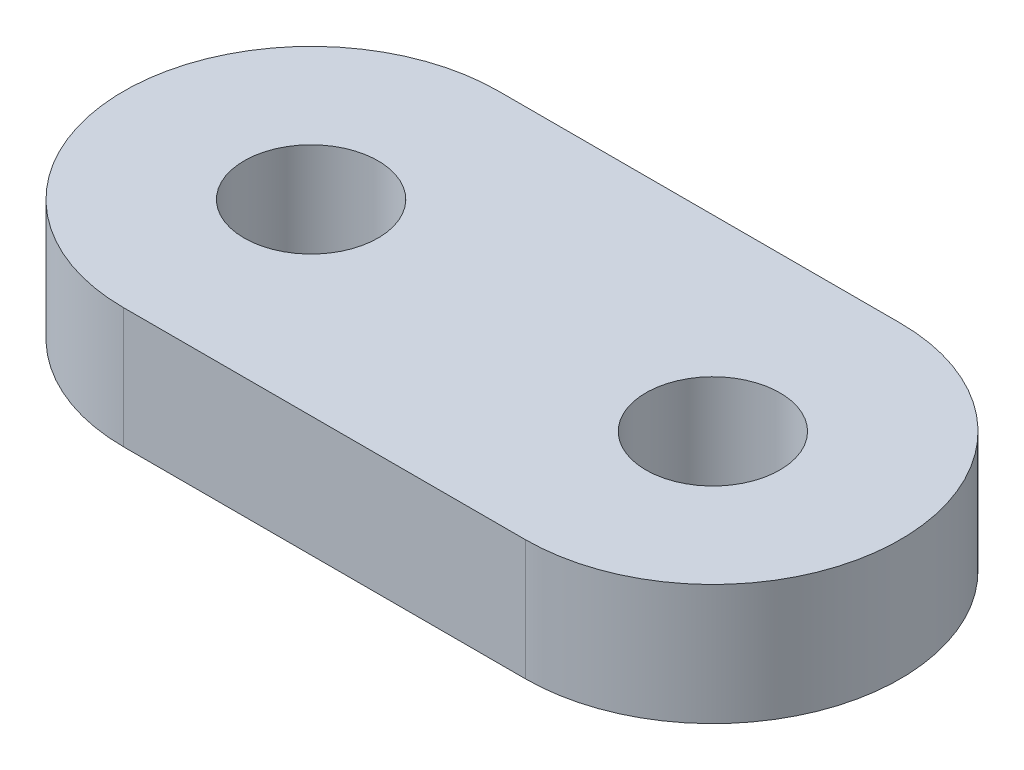
from build123d import *

# Parameters (mm, degrees)
SKETCH_1_R      = 2.5
EXTRUDE_1_DEPTH = 4.5


with BuildPart() as part:
    # Эскиз1 → Вытянуть1 (new body)
    with BuildSketch(Plane(origin=(0, 0, 0), x_dir=(1, 0, 0), z_dir=(0, 1, 0))):
        with BuildLine():
            Line((15, 7), (30, 7))
            ThreePointArc((30, 7), (37, 0), (30, -7))
            Line((30, -7), (15, -7))
            ThreePointArc((15, -7), (8, 0), (15, 7))
        make_face()
        with Locations((15, 0)):
            Circle(SKETCH_1_R, mode=Mode.SUBTRACT)
        with Locations((30, 0)):
            Circle(SKETCH_1_R, mode=Mode.SUBTRACT)
    extrude(amount=EXTRUDE_1_DEPTH)


solid = part.part
